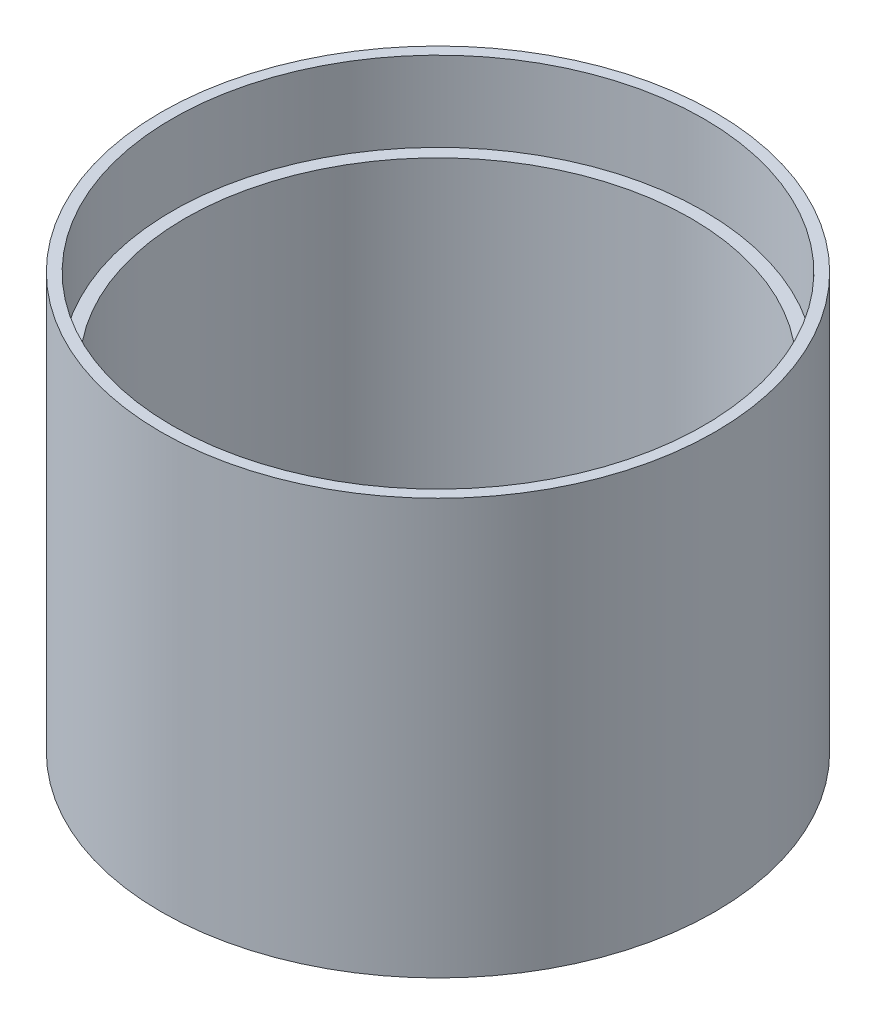
from build123d import *

# Parameters (mm, degrees)
SKETCH1_R           = 26
SKETCH1_R_2         = 24.95
BOSS_EXTRUDE1_DEPTH = 7.5
BOSS_EXTRUDE2_START = 31.5
SKETCH2_R           = 26
SKETCH2_R_2         = 23.75
BOSS_EXTRUDE2_DEPTH = 31.5
SKETCH3_R           = 23.75
BOSS_EXTRUDE3_DEPTH = 1
SKETCH4_R           = 3
CUT_EXTRUDE1_DEPTH  = 1


with BuildPart() as part:
    # Sketch1 → Boss-Extrude1 (new body)
    with BuildSketch(Plane(origin=(0, 0, 0), x_dir=(1, 0, 0), z_dir=(0, 1, 0))):
        Circle(SKETCH1_R)
        Circle(SKETCH1_R_2, mode=Mode.SUBTRACT)
    extrude(amount=BOSS_EXTRUDE1_DEPTH)

    # Sketch2 → Boss-Extrude2 (add)
    with BuildSketch(Plane.XZ.offset(BOSS_EXTRUDE2_START)):
        Circle(SKETCH2_R)
        Circle(SKETCH2_R_2, mode=Mode.SUBTRACT)
    extrude(amount=-BOSS_EXTRUDE2_DEPTH)

    # Sketch3 → Boss-Extrude3 (add)
    with BuildSketch(Plane.XZ.offset(31.5)):
        Circle(SKETCH3_R)
    extrude(amount=-BOSS_EXTRUDE3_DEPTH)

    # Sketch4 → Cut-Extrude1 (cut)
    with BuildSketch(Plane.XZ.offset(31.5)):
        Circle(SKETCH4_R)
    extrude(amount=-CUT_EXTRUDE1_DEPTH, mode=Mode.SUBTRACT)


solid = part.part
